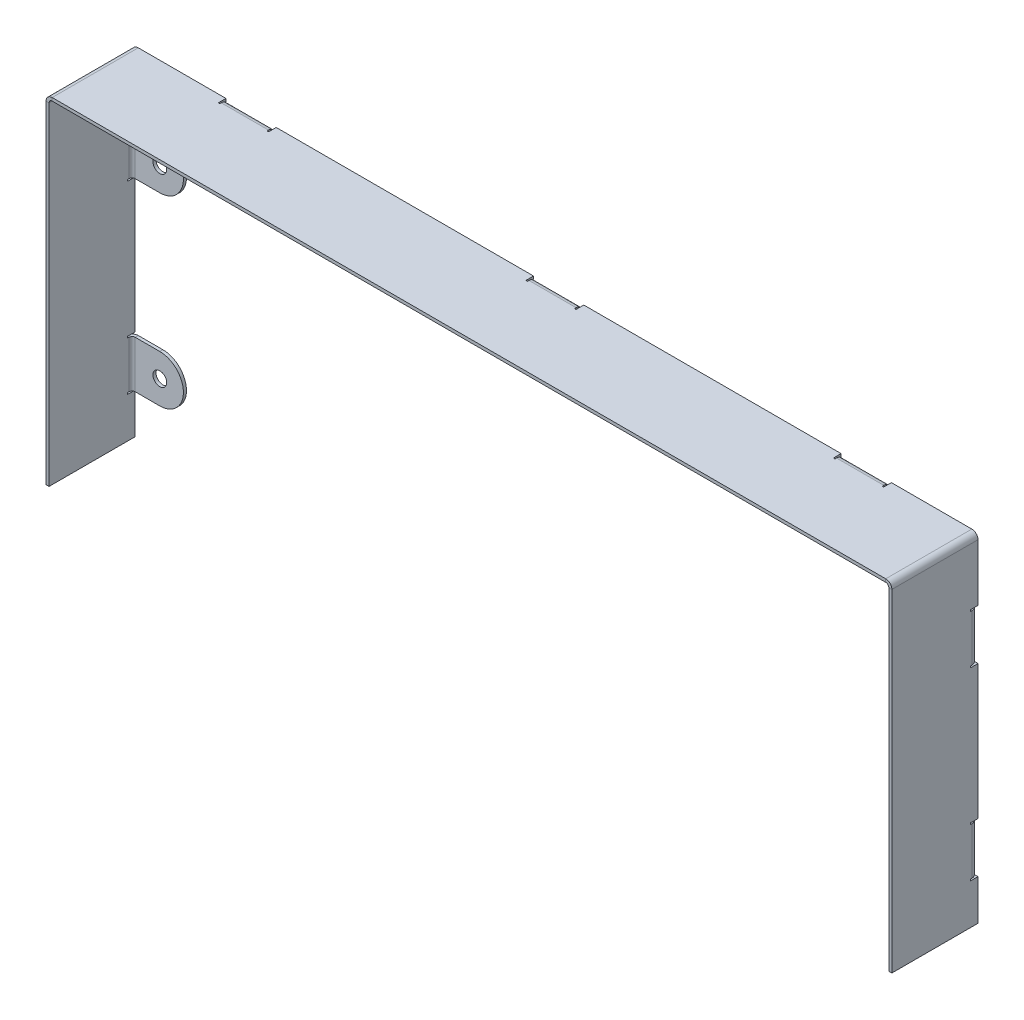
from build123d import *

# Parameters (mm, degrees)
SM_BASE_FLANGE_1_DEPTH            = 28
SM_EDGE_FLANGE_1_STRIP_W          = 6
SM_EDGE_FLANGE_1_STRIP_H          = 1
SM_EDGE_FLANGE_1_STRIP_CUT_DEPTH  = 15.34
SM_EDGE_FLANGE_1_RELIEF_W         = 6.5
SM_EDGE_FLANGE_1_RELIEF_H         = 0.5
SM_EDGE_FLANGE_1_RELIEF_CUT_DEPTH = 1
SM_EDGE_FLANGE_1_DEPTH            = 15.34
SM_EDGE_FLANGE_1_PROFILE_R        = 2.231207153
SM_EDGE_FLANGE_1_FLAT_DEPTH       = 1
PATTERN_LINEAR_1_COUNT            = 2
PATTERN_LINEAR_1_PITCH            = 60
MIRROR_1_COPY_1_SKETCH_W          = 6
MIRROR_1_COPY_1_SKETCH_H          = 1
MIRROR_1_COPY_1_DEPTH             = 15.34
MIRROR_1_COPY_2_SKETCH_W          = 6.5
MIRROR_1_COPY_2_SKETCH_H          = 0.5
MIRROR_1_COPY_2_DEPTH             = 1
MIRROR_1_COPY_3_DEPTH             = 15.34
MIRROR_1_COPY_4_SKETCH_R          = 2.231207153
MIRROR_1_COPY_4_DEPTH             = 1
SM_EDGE_FLANGE_2_STRIP_W          = 6
SM_EDGE_FLANGE_2_STRIP_H          = 1
SM_EDGE_FLANGE_2_STRIP_CUT_DEPTH  = 15.34
SM_EDGE_FLANGE_2_RELIEF_W         = 6.5
SM_EDGE_FLANGE_2_RELIEF_H         = 0.5
SM_EDGE_FLANGE_2_RELIEF_CUT_DEPTH = 1
SM_EDGE_FLANGE_2_DEPTH            = 15.34
SM_EDGE_FLANGE_2_PROFILE_R        = 2.231207153
SM_EDGE_FLANGE_2_FLAT_DEPTH       = 1
PATTERN_LINEAR_2_COUNT            = 3
PATTERN_LINEAR_2_PITCH            = 100


# Sheet-metal steps are written as plain solids
with BuildPart() as part:
    # Sketch 2 → Базовая кромка1 (new body)
    with BuildSketch(Plane.XY):
        with BuildLine():
            Line((-137.5, 0), (-137.5, 108))
            ThreePointArc((-137.5, 108), (-136.914213562, 109.414213562), (-135.5, 110))
            Line((-135.5, 110), (135.5, 110))
            ThreePointArc((135.5, 110), (136.914213562, 109.414213562), (137.5, 108))
            Line((137.5, 108), (137.5, 0))
            Line((137.5, 0), (136.5, 0))
            Line((136.5, 0), (136.5, 108))
            ThreePointArc((136.5, 108), (136.207106781, 108.707106781), (135.5, 109))
            Line((135.5, 109), (-135.5, 109))
            ThreePointArc((-135.5, 109), (-136.207106781, 108.707106781), (-136.5, 108))
            Line((-136.5, 108), (-136.5, 0))
            Line((-136.5, 0), (-137.5, 0))
        make_face()
    extrude(amount=SM_BASE_FLANGE_1_DEPTH)

    # Ребро-кромка1 strip (across the edge) → Ребро-кромка1 strip cut (cut)
    with BuildSketch(Plane(origin=(136.5, 89, 0), x_dir=(0, 0, 1), z_dir=(0, -1, 0))):
        with Locations((-1, -0.5)):
            Rectangle(SM_EDGE_FLANGE_1_STRIP_W, SM_EDGE_FLANGE_1_STRIP_H)
    sm_edge_flange_1_strip_cut = extrude(amount=SM_EDGE_FLANGE_1_STRIP_CUT_DEPTH, mode=Mode.SUBTRACT)

    # Ребро-кромка1 relief (on the sheet) → Ребро-кромка1 relief cut (cut)
    with BuildSketch(Plane(origin=(136.5, 89, 2), x_dir=(0, 0, 1), z_dir=(-1, 0, 0))):
        with Locations((-2.75, 0.25)):
            Rectangle(SM_EDGE_FLANGE_1_RELIEF_W, SM_EDGE_FLANGE_1_RELIEF_H)
        with Locations((-2.75, -15.59)):
            Rectangle(SM_EDGE_FLANGE_1_RELIEF_W, SM_EDGE_FLANGE_1_RELIEF_H)
    sm_edge_flange_1_relief_cut = extrude(amount=-SM_EDGE_FLANGE_1_RELIEF_CUT_DEPTH, mode=Mode.SUBTRACT)

    # Ребро-кромка1 bend section (across the edge) → Ребро-кромка1 (add)
    with BuildSketch(Plane(origin=(136.5, 89, 0), x_dir=(0, 0, 1), z_dir=(0, -1, 0))):
        with BuildLine():
            Line((0, 1), (1, 1))
            ThreePointArc((1, 1), (1.292893219, 0.292893219), (2, 0))
            Line((2, 0), (2, -1))
            ThreePointArc((2, -1), (0.585786438, -0.414213562), (0, 1))
        make_face()
    sm_edge_flange_1 = extrude(amount=SM_EDGE_FLANGE_1_DEPTH)

    # Ребро-кромка1 profile (on flange) → Ребро-кромка1 flat (add)
    with BuildSketch(Plane(origin=(136.5, 0, 0), x_dir=(0, -1, 0), z_dir=(0, 0, -1))):
        with BuildLine():
            ThreePointArc((-73.66, 9), (-81.33, 16.67), (-89, 9))
            Line((-89, 9), (-89, 1))
            Line((-89, 1), (-73.66, 1))
            Line((-73.66, 1), (-73.66, 9))
        make_face()
        with Locations((-81.33, 9)):
            Circle(SM_EDGE_FLANGE_1_PROFILE_R, mode=Mode.SUBTRACT)
    sm_edge_flange_1_flat = extrude(amount=-SM_EDGE_FLANGE_1_FLAT_DEPTH)

    # Линейный массив1: Ребро-кромка1 strip cut, Ребро-кромка1 relief cut, Ребро-кромка1, Ребро-кромка1 flat ×2
    with Locations(*[(0, -i * PATTERN_LINEAR_1_PITCH, 0) for i in range(1, PATTERN_LINEAR_1_COUNT)]):
        add(sm_edge_flange_1_strip_cut, mode=Mode.SUBTRACT)
        add(sm_edge_flange_1_relief_cut, mode=Mode.SUBTRACT)
        add(sm_edge_flange_1)
        add(sm_edge_flange_1_flat)

    # Зеркальное отражение1: Ребро-кромка1 strip cut, Ребро-кромка1 relief cut, Ребро-кромка1, Ребро-кромка1 flat across plane
    add(sm_edge_flange_1_strip_cut.mirror(Plane(origin=(0, 0, 0), x_dir=(0, 0, 1), z_dir=(1, 0, 0))), mode=Mode.SUBTRACT)
    add(sm_edge_flange_1_relief_cut.mirror(Plane(origin=(0, 0, 0), x_dir=(0, 0, 1), z_dir=(1, 0, 0))), mode=Mode.SUBTRACT)
    add(sm_edge_flange_1.mirror(Plane(origin=(0, 0, 0), x_dir=(0, 0, 1), z_dir=(1, 0, 0))))
    add(sm_edge_flange_1_flat.mirror(Plane(origin=(0, 0, 0), x_dir=(0, 0, 1), z_dir=(1, 0, 0))))

    # Зеркальное отражение1 copy 1 sketch → Зеркальное отражение1 copy 1 (cut)
    with BuildSketch(Plane(origin=(-136.5, 29, 0), x_dir=(0, 0, 1), z_dir=(0, -1, 0))):
        with Locations((-1, 0.5)):
            Rectangle(MIRROR_1_COPY_1_SKETCH_W, MIRROR_1_COPY_1_SKETCH_H)
    extrude(amount=MIRROR_1_COPY_1_DEPTH, mode=Mode.SUBTRACT)

    # Зеркальное отражение1 copy 2 sketch → Зеркальное отражение1 copy 2 (cut)
    with BuildSketch(Plane(origin=(-136.5, 29, 2), x_dir=(0, 0, 1), z_dir=(1, 0, 0))):
        with Locations((-2.75, -0.25)):
            Rectangle(MIRROR_1_COPY_2_SKETCH_W, MIRROR_1_COPY_2_SKETCH_H)
        with Locations((-2.75, 15.59)):
            Rectangle(MIRROR_1_COPY_2_SKETCH_W, MIRROR_1_COPY_2_SKETCH_H)
    extrude(amount=-MIRROR_1_COPY_2_DEPTH, mode=Mode.SUBTRACT)

    # Зеркальное отражение1 copy 3 sketch → Зеркальное отражение1 copy 3 (add)
    with BuildSketch(Plane(origin=(-136.5, 29, 0), x_dir=(0, 0, 1), z_dir=(0, -1, 0))):
        with BuildLine():
            Line((0, -1), (1, -1))
            ThreePointArc((1, -1), (1.292893219, -0.292893219), (2, 0))
            Line((2, 0), (2, 1))
            ThreePointArc((2, 1), (0.585786438, 0.414213562), (0, -1))
        make_face()
    extrude(amount=MIRROR_1_COPY_3_DEPTH)

    # Зеркальное отражение1 copy 4 sketch → Зеркальное отражение1 copy 4 (add)
    with BuildSketch(Plane(origin=(-136.5, -60, 0), x_dir=(0, -1, 0), z_dir=(0, 0, -1))):
        with BuildLine():
            ThreePointArc((-73.66, -9), (-81.33, -16.67), (-89, -9))
            Line((-89, -9), (-89, -1))
            Line((-89, -1), (-73.66, -1))
            Line((-73.66, -1), (-73.66, -9))
        make_face()
        with Locations((-81.33, -9)):
            Circle(MIRROR_1_COPY_4_SKETCH_R, mode=Mode.SUBTRACT)
    extrude(amount=-MIRROR_1_COPY_4_DEPTH)

    # Ребро-кромка2 strip (across the edge) → Ребро-кромка2 strip cut (cut)
    with BuildSketch(Plane(origin=(-106.5, 109, 0), x_dir=(0, 0, 1), z_dir=(1, 0, 0))):
        with Locations((-1, -0.5)):
            Rectangle(SM_EDGE_FLANGE_2_STRIP_W, SM_EDGE_FLANGE_2_STRIP_H)
    sm_edge_flange_2_strip_cut = extrude(amount=SM_EDGE_FLANGE_2_STRIP_CUT_DEPTH, mode=Mode.SUBTRACT)

    # Ребро-кромка2 relief (on the sheet) → Ребро-кромка2 relief cut (cut)
    with BuildSketch(Plane(origin=(-106.5, 109, 2), x_dir=(0, 0, 1), z_dir=(0, -1, 0))):
        with Locations((-2.75, 0.25)):
            Rectangle(SM_EDGE_FLANGE_2_RELIEF_W, SM_EDGE_FLANGE_2_RELIEF_H)
        with Locations((-2.75, -15.59)):
            Rectangle(SM_EDGE_FLANGE_2_RELIEF_W, SM_EDGE_FLANGE_2_RELIEF_H)
    sm_edge_flange_2_relief_cut = extrude(amount=-SM_EDGE_FLANGE_2_RELIEF_CUT_DEPTH, mode=Mode.SUBTRACT)

    # Ребро-кромка2 bend section (across the edge) → Ребро-кромка2 (add)
    with BuildSketch(Plane(origin=(-106.5, 109, 0), x_dir=(0, 0, 1), z_dir=(1, 0, 0))):
        with BuildLine():
            Line((0, 1), (1, 1))
            ThreePointArc((1, 1), (1.292893219, 0.292893219), (2, 0))
            Line((2, 0), (2, -1))
            ThreePointArc((2, -1), (0.585786438, -0.414213562), (0, 1))
        make_face()
    sm_edge_flange_2 = extrude(amount=SM_EDGE_FLANGE_2_DEPTH)

    # Ребро-кромка2 profile (on flange) → Ребро-кромка2 flat (add)
    with BuildSketch(Plane(origin=(0, 109, 0), x_dir=(1, 0, 0), z_dir=(0, 0, -1))):
        with BuildLine():
            ThreePointArc((-91.16, 8), (-98.829997184, 15.670005632), (-106.5, 8.000005632))
            Line((-106.5, 8.000005632), (-106.5, 1))
            Line((-106.5, 1), (-91.16, 1))
            Line((-91.16, 1), (-91.16, 8))
        make_face()
        with Locations((-98.83, 8.000005632)):
            Circle(SM_EDGE_FLANGE_2_PROFILE_R, mode=Mode.SUBTRACT)
    sm_edge_flange_2_flat = extrude(amount=-SM_EDGE_FLANGE_2_FLAT_DEPTH)

    # Линейный массив2: Ребро-кромка2 strip cut, Ребро-кромка2 relief cut, Ребро-кромка2, Ребро-кромка2 flat ×3
    with Locations(*[(i * PATTERN_LINEAR_2_PITCH, 0, 0) for i in range(1, PATTERN_LINEAR_2_COUNT)]):
        add(sm_edge_flange_2_strip_cut, mode=Mode.SUBTRACT)
        add(sm_edge_flange_2_relief_cut, mode=Mode.SUBTRACT)
        add(sm_edge_flange_2)
        add(sm_edge_flange_2_flat)


solid = part.part
